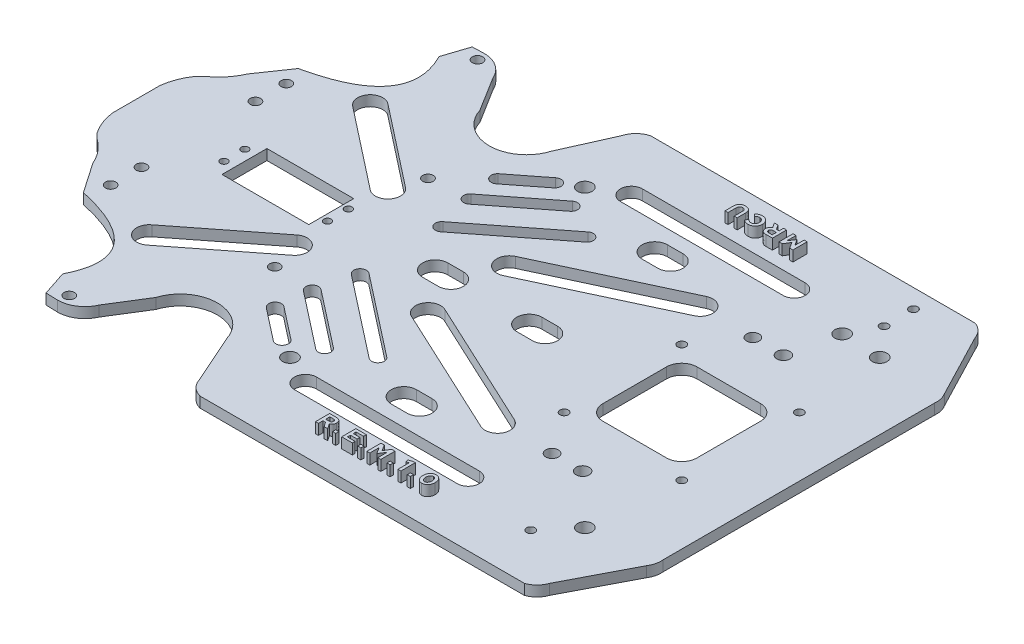
from build123d import *

# Parameters (mm, degrees)
SKETCH1_R           = 2.5
SKETCH1_R_2         = 3.5
SKETCH1_R_3         = 2
SKETCH1_R_4         = 3
SKETCH1_R_5         = 3.15
SKETCH1_R_6         = 1.75
SKETCH1_W           = 41.5
SKETCH1_H           = 21.5
BOSS_EXTRUDE1_DEPTH = 5
WRAP1_START         = -10
WRAP1_OUTLINE_W     = 1.506426403
WRAP1_OUTLINE_H     = 1.506425041
WRAP1_OUTLINE_W_2   = 1.506426404
WRAP1_DEPTH         = 5


# Read off the part's stored shape, not the designer's step: Wrap1
with BuildPart() as part:
    # Sketch1 → Boss-Extrude1 (new body)
    with BuildSketch(Plane(origin=(0, 0, 0), x_dir=(1, 0, 0), z_dir=(0, 1, 0))):
        with BuildLine():
            Line((-131.97838276, 25.717888608), (-134.624078241, 23.072193127))
            ThreePointArc((-134.624078241, 23.072193127), (-137.62017418, 17.349874646), (-139.171800992, 11.079789007))
            Line((-139.171800992, 11.079789007), (-139.171800992, -11.585375555))
            ThreePointArc((-139.171800992, -11.585375555), (-137.62017418, -17.855461194), (-134.624078241, -23.577779675))
            Line((-134.624078241, -23.577779675), (-131.97838276, -26.223475156))
            ThreePointArc((-131.97838276, -26.223475156), (-126.720677985, -31.130670242), (-122.996132988, -37.283050893))
            Line((-122.996132988, -37.283050893), (-113.160451932, -51.598877887))
            add(Edge.make_bspline(
                [(-113.160451932, -51.598877887), (-69.655489411, -61.18576478), (-84.427649619, -90.240012804)],
                knots=[0, 0, 0, 1, 1, 1], degree=2))
            Line((-84.427649619, -90.240012804), (-80.508790139, -102.148859929))
            Line((-80.508790139, -102.148859929), (-74.827782519, -102.329739895))
            ThreePointArc((-74.827782519, -102.329739895), (-67.636098928, -100.180544234), (-62.810313036, -94.431531678))
            Line((-62.810313036, -94.431531678), (-52.418708237, -77.753553279))
            ThreePointArc((-52.418708237, -77.753553279), (-35.436573268, -65.267780368), (-18.4544383, -77.753553279))
            Line((-18.4544383, -77.753553279), (-8.014534935, -101.180532239))
            ThreePointArc((-8.014534935, -101.180532239), (-5.407463763, -105.532372171), (-0.984727721, -108.017273936))
            Line((-0.984727721, -108.017273936), (154.08956069, -108.017273936))
            ThreePointArc((154.08956069, -108.017273936), (157.81628998, -105.69688437), (160.148298335, -101.977414519))
            Line((160.148298335, -101.977414519), (176.019668314, -71.459248868))
            ThreePointArc((176.019668314, -71.459248868), (177.308728073, -68.443791093), (177.525663914, -65.171544236))
            Line((177.525663914, -65.171544236), (177.525663914, 64.665957688))
            ThreePointArc((177.525663914, 64.665957688), (177.308728073, 67.938204545), (176.019668314, 70.95366232))
            Line((176.019668314, 70.95366232), (160.148298335, 101.471827971))
            ThreePointArc((160.148298335, 101.471827971), (157.81628998, 105.191297821), (154.08956069, 107.511687388))
            Line((154.08956069, 107.511687388), (-0.984727721, 107.511687388))
            ThreePointArc((-0.984727721, 107.511687388), (-5.407463763, 105.026785622), (-8.014534935, 100.674945691))
            Line((-8.014534935, 100.674945691), (-18.4544383, 77.247966731))
            ThreePointArc((-18.4544383, 77.247966731), (-35.436573268, 64.76219382), (-52.418708237, 77.247966731))
            Line((-52.418708237, 77.247966731), (-62.810313036, 93.925945129))
            ThreePointArc((-62.810313036, 93.925945129), (-67.636098928, 99.674957686), (-74.827782519, 101.824153347))
            Line((-74.827782519, 101.824153347), (-80.508790139, 101.643273381))
            Line((-80.508790139, 101.643273381), (-84.427649619, 89.734426256))
            add(Edge.make_bspline(
                [(-84.427649619, 89.734426256), (-69.655489411, 60.680178232), (-113.160451932, 51.093291339)],
                knots=[0, 0, 0, 1, 1, 1], degree=2))
            Line((-113.160451932, 51.093291339), (-122.996132988, 36.777464345))
            ThreePointArc((-122.996132988, 36.777464345), (-126.720677985, 30.625083694), (-131.97838276, 25.717888608))
        make_face()
        with Locations(Location((-36.642164959, 36.630202961, 0), (0, 0, 270))):
            Circle(SKETCH1_R, mode=Mode.SUBTRACT)
        with Locations(Location((-36.642164959, -36.630202961, 0), (0, 0, 270))):
            Circle(SKETCH1_R, mode=Mode.SUBTRACT)
        with Locations(Location((-73.905296724, -97.603035068, 0), (0, 0, 270))):
            Circle(SKETCH1_R, mode=Mode.SUBTRACT)
        with Locations(Location((-73.905296724, 97.603035068, 0), (0, 0, 270))):
            Circle(SKETCH1_R, mode=Mode.SUBTRACT)
        with Locations(Location((-109.755224174, -27.254093608, 0), (0, 0, 270))):
            Circle(SKETCH1_R, mode=Mode.SUBTRACT)
        with Locations(Location((145.5, 70.5, 0), (0, 0, 270))):
            Circle(SKETCH1_R_2, mode=Mode.SUBTRACT)
        with Locations(Location((4.5, 70.5, 0), (0, 0, 270))):
            Circle(SKETCH1_R_2, mode=Mode.SUBTRACT)
        with Locations(Location((4.5, -70.5, 0), (0, 0, 270))):
            Circle(SKETCH1_R_2, mode=Mode.SUBTRACT)
        with Locations(Location((145.5, -70.5, 0), (0, 0, 270))):
            Circle(SKETCH1_R_2, mode=Mode.SUBTRACT)
        with Locations(Location((-109.755224174, -41.994093608, 0), (0, 0, 270))):
            Circle(SKETCH1_R, mode=Mode.SUBTRACT)
        with Locations(Location((-109.755224174, 41.994093608, 0), (0, 0, 270))):
            Circle(SKETCH1_R, mode=Mode.SUBTRACT)
        with Locations(Location((-109.755224174, 27.254093608, 0), (0, 0, 270))):
            Circle(SKETCH1_R, mode=Mode.SUBTRACT)
        with Locations(Location((133.617169417, -84.482617886, 0), (0, 0, 270))):
            Circle(SKETCH1_R_3, mode=Mode.SUBTRACT)
        with Locations(Location((133.617169417, 84.482617886, 0), (0, 0, 270))):
            Circle(SKETCH1_R_3, mode=Mode.SUBTRACT)
        with Locations(Location((133.617169417, 98.534958019, 0), (0, 0, 270))):
            Circle(SKETCH1_R_3, mode=Mode.SUBTRACT)
        with Locations(Location((126.785350398, 71.251763002, 0), (0, 0, 270))):
            Circle(SKETCH1_R_2, mode=Mode.SUBTRACT)
        with Locations(Location((106.941717469, 48.397168049, 0), (0, 0, 270))):
            Circle(SKETCH1_R_4, mode=Mode.SUBTRACT)
        with Locations(Location((121.566717469, 48.397168049, 0), (0, 0, 270))):
            Circle(SKETCH1_R_5, mode=Mode.SUBTRACT)
        with Locations(Location((149.066717469, -27.727831951, 0), (0, 0, 270))):
            Circle(SKETCH1_R_3, mode=Mode.SUBTRACT)
        with Locations(Location((121.566717469, -47.602831951, 0), (0, 0, 270))):
            Circle(SKETCH1_R_5, mode=Mode.SUBTRACT)
        with Locations(Location((106.941717469, -47.602831951, 0), (0, 0, 270))):
            Circle(SKETCH1_R_4, mode=Mode.SUBTRACT)
        with Locations(Location((149.066717469, 28.522168049, 0), (0, 0, 270))):
            Circle(SKETCH1_R_3, mode=Mode.SUBTRACT)
        with Locations(Location((92.816717469, 28.522168049, 0), (0, 0, 270))):
            Circle(SKETCH1_R_3, mode=Mode.SUBTRACT)
        with Locations(Location((92.816717469, -27.727831951, 0), (0, 0, 270))):
            Circle(SKETCH1_R_3, mode=Mode.SUBTRACT)
        with Locations(Location((-92.478968026, 4.913375905, 0), (0, 0, 270))):
            Circle(SKETCH1_R_6, mode=Mode.SUBTRACT)
        with Locations(Location((-92.478968026, -5.086624095, 0), (0, 0, 270))):
            Circle(SKETCH1_R_6, mode=Mode.SUBTRACT)
        with Locations(Location((-42.978968026, -5.086624095, 0), (0, 0, 270))):
            Circle(SKETCH1_R_6, mode=Mode.SUBTRACT)
        with Locations(Location((-42.978968026, 4.913375905, 0), (0, 0, 270))):
            Circle(SKETCH1_R_6, mode=Mode.SUBTRACT)
        with BuildLine():
            Line((-18.104688203, 50.654148611), (-2.738478508, 62.65954738))
            ThreePointArc((-2.738478508, 62.65954738), (-2.129164012, 66.945049932), (-6.436015983, 67.378434735))
            Line((-6.436015983, 67.378434735), (-21.802225678, 55.373035966))
            ThreePointArc((-21.802225678, 55.373035966), (-22.218219335, 51.23901214), (-18.104688203, 50.654148611))
        make_face(mode=Mode.SUBTRACT)
        with BuildLine():
            Line((21.618278356, 14.369542206), (83.873848516, 43.399791334))
            ThreePointArc((83.873848516, 43.399791334), (86.775985667, 51.373347626), (78.802429375, 54.275484778))
            Line((78.802429375, 54.275484778), (16.546859215, 25.24523565))
            ThreePointArc((16.546859215, 25.24523565), (13.644722064, 17.271679357), (21.618278356, 14.369542206))
        make_face(mode=Mode.SUBTRACT)
        with BuildLine():
            Line((55.566717469, 66.397168049), (48.066717469, 66.397168049))
            ThreePointArc((48.066717469, 66.397168049), (42.066717469, 60.397168049), (48.066717469, 54.397168049))
            Line((48.066717469, 54.397168049), (55.566717469, 54.397168049))
            ThreePointArc((55.566717469, 54.397168049), (61.566717469, 60.397168049), (55.566717469, 66.397168049))
        make_face(mode=Mode.SUBTRACT)
        with BuildLine():
            Line((18.952031041, 73.069651302), (96.809281898, 73.069651302))
            ThreePointArc((96.809281898, 73.069651302), (102.059281898, 78.319651302), (96.809281898, 83.569651302))
            Line((96.809281898, 83.569651302), (18.952031041, 83.569651302))
            ThreePointArc((18.952031041, 83.569651302), (13.702031041, 78.319651302), (18.952031041, 73.069651302))
        make_face(mode=Mode.SUBTRACT)
        with BuildLine():
            Line((55.566717469, 6.397168049), (48.066717469, 6.397168049))
            ThreePointArc((48.066717469, 6.397168049), (42.066717469, 0.397168049), (48.066717469, -5.602831951))
            Line((48.066717469, -5.602831951), (55.566717469, -5.602831951))
            ThreePointArc((55.566717469, -5.602831951), (61.566717469, 0.397168049), (55.566717469, 6.397168049))
        make_face(mode=Mode.SUBTRACT)
        with BuildLine():
            Line((98.441717469, 15.589450855), (98.441717469, -14.795114757))
            ThreePointArc((98.441717469, -14.795114757), (100.58209828, -19.96245114), (105.749434663, -22.102831951))
            Line((105.749434663, -22.102831951), (136.134000275, -22.102831951))
            ThreePointArc((136.134000275, -22.102831951), (141.301336658, -19.96245114), (143.441717469, -14.795114757))
            Line((143.441717469, -14.795114757), (143.441717469, 15.589450855))
            ThreePointArc((143.441717469, 15.589450855), (141.301336658, 20.756787238), (136.134000275, 22.897168049))
            Line((136.134000275, 22.897168049), (105.749434663, 22.897168049))
            ThreePointArc((105.749434663, 22.897168049), (100.58209828, 20.756787238), (98.441717469, 15.589450855))
        make_face(mode=Mode.SUBTRACT)
        with BuildLine():
            Line((83.873848516, -42.605455236), (21.618278356, -13.575206108))
            ThreePointArc((21.618278356, -13.575206108), (13.644722064, -16.477343259), (16.546859215, -24.450899552))
            Line((16.546859215, -24.450899552), (78.802429375, -53.48114868))
            ThreePointArc((78.802429375, -53.48114868), (86.775985667, -50.579011528), (83.873848516, -42.605455236))
        make_face(mode=Mode.SUBTRACT)
        with BuildLine():
            Line((55.566717469, -53.602831951), (48.066717469, -53.602831951))
            ThreePointArc((48.066717469, -53.602831951), (42.066717469, -59.602831951), (48.066717469, -65.602831951))
            Line((48.066717469, -65.602831951), (55.566717469, -65.602831951))
            ThreePointArc((55.566717469, -65.602831951), (61.566717469, -59.602831951), (55.566717469, -53.602831951))
        make_face(mode=Mode.SUBTRACT)
        with BuildLine():
            Line((96.809281898, -72.275315204), (18.952031041, -72.275315204))
            ThreePointArc((18.952031041, -72.275315204), (13.702031041, -77.525315204), (18.952031041, -82.775315204))
            Line((18.952031041, -82.775315204), (96.809281898, -82.775315204))
            ThreePointArc((96.809281898, -82.775315204), (102.059281898, -77.525315204), (96.809281898, -72.275315204))
        make_face(mode=Mode.SUBTRACT)
        with BuildLine():
            Line((-2.738478508, -62.815802297), (-18.104688203, -50.810403528))
            ThreePointArc((-18.104688203, -50.810403528), (-22.218219335, -51.395267057), (-21.802225678, -55.529290883))
            Line((-21.802225678, -55.529290883), (-6.436015983, -67.534689652))
            ThreePointArc((-6.436015983, -67.534689652), (-2.129164012, -67.101304849), (-2.738478508, -62.815802297))
        make_face(mode=Mode.SUBTRACT)
        with BuildLine():
            Line((10.974941138, -56.189767154), (-16.211429862, -34.949446255))
            ThreePointArc((-16.211429862, -34.949446255), (-20.422446548, -35.46649409), (-19.905398714, -39.677510776))
            Line((-19.905398714, -39.677510776), (7.280972286, -60.917831675))
            ThreePointArc((7.280972286, -60.917831675), (11.491988973, -60.40078384), (10.974941138, -56.189767154))
        make_face(mode=Mode.SUBTRACT)
        with BuildLine():
            Line((27.505182239, -47.214042719), (-11.501350064, -16.73879969))
            ThreePointArc((-11.501350064, -16.73879969), (-15.712366751, -17.255847525), (-15.195318916, -21.466864212))
            Line((-15.195318916, -21.466864212), (23.811213387, -51.94210724))
            ThreePointArc((23.811213387, -51.94210724), (28.022230074, -51.425059406), (27.505182239, -47.214042719))
        make_face(mode=Mode.SUBTRACT)
        with BuildLine():
            Line((10.566717469, 6.397168049), (3.066717469, 6.397168049))
            ThreePointArc((3.066717469, 6.397168049), (-2.933282531, 0.397168049), (3.066717469, -5.602831951))
            Line((3.066717469, -5.602831951), (10.566717469, -5.602831951))
            ThreePointArc((10.566717469, -5.602831951), (16.566717469, 0.397168049), (10.566717469, 6.397168049))
        make_face(mode=Mode.SUBTRACT)
        with BuildLine():
            Line((-11.501350064, 17.533135788), (27.505182239, 48.008378817))
            ThreePointArc((27.505182239, 48.008378817), (28.022230074, 52.219395504), (23.811213387, 52.736443338))
            Line((23.811213387, 52.736443338), (-15.195318916, 22.26120031))
            ThreePointArc((-15.195318916, 22.26120031), (-15.712366751, 18.050183623), (-11.501350064, 17.533135788))
        make_face(mode=Mode.SUBTRACT)
        with BuildLine():
            Line((-16.211429862, 35.743782353), (10.974941138, 56.984103252))
            ThreePointArc((10.974941138, 56.984103252), (11.491988973, 61.195119938), (7.280972286, 61.712167773))
            Line((7.280972286, 61.712167773), (-19.905398714, 40.471846874))
            ThreePointArc((-19.905398714, 40.471846874), (-20.422446548, 36.260830188), (-16.211429862, 35.743782353))
        make_face(mode=Mode.SUBTRACT)
        with BuildLine():
            Line((-38.099872951, 27.371804876), (-77.060715194, 57.905438327))
            ThreePointArc((-77.060715194, 57.905438327), (-85.580659628, 56.963835582), (-84.464587763, 48.464985514))
            Line((-84.464587763, 48.464985514), (-45.50374552, 17.931352063))
            ThreePointArc((-45.50374552, 17.931352063), (-37.177380086, 19.024773187), (-38.099872951, 27.371804876))
        make_face(mode=Mode.SUBTRACT)
        with BuildLine():
            Line((-44.50374552, -18.08760698), (-83.464587763, -48.621240431))
            ThreePointArc((-83.464587763, -48.621240431), (-84.580659628, -57.1200905), (-76.060715194, -58.061693245))
            Line((-76.060715194, -58.061693245), (-37.099872951, -27.528059794))
            ThreePointArc((-37.099872951, -27.528059794), (-36.177380086, -19.181028105), (-44.50374552, -18.08760698))
        make_face(mode=Mode.SUBTRACT)
        with Locations((-66.759608096, -0.25)):
            Rectangle(SKETCH1_W, SKETCH1_H, mode=Mode.SUBTRACT)
    extrude(amount=BOSS_EXTRUDE1_DEPTH)

    # Wrap1 outline → Wrap1 (add)
    # profile 1 of 13: a face of its own
    with BuildSketch(Plane(origin=(0, 15, 0), x_dir=(1, 0, 0), z_dir=(0, 1, 0)).offset(WRAP1_START)):
        with BuildLine():
            Line((48.019988529, -96.011695946), (46.454869958, -93.610215346))
            add(Edge.make_bspline(
                [(46.454869958, -93.610215346), (46.504926209, -93.589905955), (46.604332063, -93.54957388), (46.746431819, -93.476129365), (46.882317989, -93.395768105), (47.009822853, -93.304874378), (47.127802598, -93.203551697), (47.240721538, -93.096488801), (47.343923833, -92.978209342), (47.440061574, -92.851854894), (47.527692434, -92.715878637), (47.602269852, -92.56923464), (47.666942527, -92.413569916), (47.719807761, -92.248350764), (47.761622276, -92.073035791), (47.792237819, -91.888031927), (47.809921129, -91.693137089), (47.814028037, -91.560334944), (47.816128324, -91.49241946)],
                knots=[0, 0, 0, 0, 0.060156755, 0.119464273, 0.178009028, 0.235938657, 0.29364319, 0.351161413, 0.409151229, 0.468309249, 0.527943894, 0.589106854, 0.651348349, 0.715565379, 0.782155878, 0.851987937, 0.924306111, 1, 1, 1, 1], degree=3))
            Line((47.816128324, -91.49241946), (47.8175218, -91.472199758))
            add(Edge.make_bspline(
                [(47.8175218, -91.472199758), (47.81493407, -91.391927622), (47.809887266, -91.235374261), (47.783607178, -91.007377036), (47.739983419, -90.792934182), (47.682200709, -90.590641067), (47.605415416, -90.401704177), (47.51076168, -90.226764215), (47.403053015, -90.062399138), (47.315770107, -89.965888478), (47.272141504, -89.917647357)],
                knots=[0, 0, 0, 0, 0.142719784, 0.278343931, 0.407360832, 0.531328976, 0.651804358, 0.769015275, 0.884541643, 1, 1, 1, 1], degree=3))
            add(Edge.make_bspline(
                [(47.272141504, -89.917647357), (47.218263671, -89.863888144), (47.109310796, -89.755175143), (46.916134411, -89.620999525), (46.703211966, -89.504276472), (46.466617607, -89.409496543), (46.207539889, -89.336036469), (45.925879171, -89.284272069), (45.622413102, -89.249936482), (45.412456383, -89.245062772), (45.304025084, -89.242545764)],
                knots=[0, 0, 0, 0, 0.10657219, 0.215512502, 0.328455042, 0.446650848, 0.572152058, 0.705556222, 0.8479357, 1, 1, 1, 1], degree=3))
            Line((45.304025084, -89.242545764), (42.204693684, -89.241879675))
            Line((42.204693684, -89.241879675), (42.204693684, -96.011695946))
            Line((42.204693684, -96.011695946), (43.621850455, -96.011695946))
            Line((43.621850455, -96.011695946), (43.621850455, -93.86088844))
            Line((43.621850455, -93.86088844), (44.848933305, -93.86088844))
            Line((44.848933305, -93.86088844), (46.370110393, -96.011695946))
            Line((46.370110393, -96.011695946), (48.019988529, -96.011695946))
        make_face()
        with BuildLine():
            Line((43.621850455, -90.56273269), (45.173451084, -90.56273269))
            add(Edge.make_bspline(
                [(45.173451084, -90.56273269), (45.219782586, -90.56394432), (45.310429066, -90.566314847), (45.442665875, -90.576911735), (45.567649249, -90.596406109), (45.684186116, -90.624120589), (45.793128525, -90.658976762), (45.893393111, -90.70225621), (45.986590883, -90.752724243), (46.071475448, -90.810884694), (46.147799831, -90.877290252), (46.214974272, -90.950790869), (46.271085976, -91.032797207), (46.317602803, -91.121655974), (46.354404834, -91.218459098), (46.378076452, -91.323751543), (46.396215247, -91.435549225), (46.39803832, -91.512796688), (46.398972915, -91.552397494)],
                knots=[0, 0, 0, 0, 0.077775575, 0.152166058, 0.222466345, 0.28984344, 0.353013683, 0.414181118, 0.472843596, 0.530632924, 0.58649361, 0.64228886, 0.697265122, 0.752759469, 0.81029538, 0.870479417, 0.933601449, 1, 1, 1, 1], degree=3))
            Line((46.398972915, -91.552397494), (46.400365029, -91.571050728))
            add(Edge.make_bspline(
                [(46.400365029, -91.571050728), (46.398678746, -91.607201216), (46.395370664, -91.678119804), (46.379733604, -91.781079901), (46.356583606, -91.879251994), (46.32119376, -91.970500653), (46.278219384, -92.05747798), (46.222341181, -92.136548344), (46.160459802, -92.212817947), (46.086572022, -92.280547819), (46.00649342, -92.344713377), (45.914586118, -92.396331089), (45.816755589, -92.443488273), (45.709774591, -92.480283696), (45.595443012, -92.511935214), (45.471883526, -92.53144112), (45.340639688, -92.546285507), (45.250137983, -92.548544804), (45.203596748, -92.549706665)],
                knots=[0, 0, 0, 0, 0.062280145, 0.122178709, 0.179075065, 0.235581385, 0.290365476, 0.345662015, 0.401940991, 0.459146338, 0.517921367, 0.578203968, 0.640164611, 0.704739313, 0.772713832, 0.844186612, 0.919871703, 1, 1, 1, 1], degree=3))
            Line((45.203596748, -92.549706665), (43.621850455, -92.549675336))
            Line((43.621850455, -92.549675336), (43.621850455, -90.56273269))
        make_face(mode=Mode.SUBTRACT)
    # profile 2 of 13: a face of its own
    with BuildSketch(Plane(origin=(0, 15, 0), x_dir=(1, 0, 0), z_dir=(0, 1, 0)).offset(WRAP1_START)):
        with BuildLine():
            Line((96.057437495, -92.626422755), (96.058830971, -92.605775339))
            add(Edge.make_bspline(
                [(96.058830971, -92.605775339), (96.054882992, -92.483771325), (96.047136169, -92.244371948), (96.007996762, -91.893566852), (95.944854788, -91.55948461), (95.861623073, -91.241109926), (95.747908028, -90.941594802), (95.615074618, -90.657327537), (95.456209852, -90.390881888), (95.275369087, -90.143147084), (95.074832194, -89.916370817), (94.850800177, -89.720097108), (94.609462824, -89.551657779), (94.349998251, -89.410394389), (94.070072272, -89.302312772), (93.772931108, -89.221230538), (93.45690449, -89.168610599), (93.239603551, -89.158470848), (93.128277693, -89.153276132)],
                knots=[0, 0, 0, 0, 0.072144134, 0.141563054, 0.208409952, 0.273017716, 0.335814469, 0.397536687, 0.45829914, 0.518884153, 0.578643629, 0.636874037, 0.694519606, 0.752322888, 0.811072552, 0.871485232, 0.934160353, 1, 1, 1, 1], degree=3))
            add(Edge.make_bspline(
                [(93.128277693, -89.153276132), (93.015994688, -89.158306288), (92.796715259, -89.168129765), (92.478691037, -89.22301312), (92.179189826, -89.303227173), (91.897906018, -89.413680688), (91.636195422, -89.555461686), (91.392734068, -89.725655454), (91.16821876, -89.924783682), (90.965857069, -90.152866732), (90.783096034, -90.402204061), (90.624322096, -90.670809056), (90.487965613, -90.955786507), (90.376449179, -91.257422357), (90.290400005, -91.576514317), (90.226171222, -91.911139534), (90.186703531, -92.26330836), (90.180150831, -92.503575728), (90.176800482, -92.626422755)],
                knots=[0, 0, 0, 0, 0.065977829, 0.128849248, 0.189152058, 0.247892821, 0.305949344, 0.363618992, 0.422055999, 0.481831844, 0.542424132, 0.603420238, 0.664878245, 0.727798899, 0.792078771, 0.858831854, 0.927821713, 1, 1, 1, 1], degree=3))
            Line((90.176800482, -92.626422755), (90.178193958, -92.644367673))
            add(Edge.make_bspline(
                [(90.178193958, -92.644367673), (90.18109443, -92.766806021), (90.186775568, -93.006625352), (90.224764834, -93.357918251), (90.287369515, -93.692286637), (90.373729817, -94.009511548), (90.483045394, -94.310110762), (90.614857848, -94.594441996), (90.773997035, -94.860134661), (90.95322415, -95.108258785), (91.152470829, -95.335471263), (91.376511037, -95.531313315), (91.617801246, -95.699771133), (91.877597785, -95.841392679), (92.158636172, -95.94907497), (92.457565999, -96.030410675), (92.775963139, -96.082801364), (92.995104188, -96.092967252), (93.107355123, -96.09817454)],
                knots=[0, 0, 0, 0, 0.072289224, 0.141592512, 0.208356853, 0.272956613, 0.335485668, 0.397014796, 0.457702206, 0.518050891, 0.577553826, 0.635712319, 0.693286695, 0.751018588, 0.809951373, 0.870554279, 0.933693833, 1, 1, 1, 1], degree=3))
            Line((93.107355123, -96.09817454), (93.108651886, -96.097448516))
            add(Edge.make_bspline(
                [(93.108651886, -96.097448516), (93.220507536, -96.092694115), (93.439837083, -96.083371559), (93.75825826, -96.028247931), (94.059585696, -95.948700402), (94.340842783, -95.836040012), (94.604042745, -95.696338905), (94.847040606, -95.525682168), (95.071524445, -95.326636541), (95.274128961, -95.099034853), (95.45505979, -94.848731601), (95.61438177, -94.581032468), (95.749082225, -94.295570718), (95.858793384, -93.993746209), (95.945567902, -93.67556599), (96.007827946, -93.340629972), (96.047512883, -92.989082265), (96.054088239, -92.748809339), (96.057437495, -92.626422755)],
                knots=[0, 0, 0, 0, 0.065728123, 0.12888146, 0.189459857, 0.248566924, 0.306505586, 0.364186636, 0.422635199, 0.482422863, 0.542866177, 0.603874344, 0.665227202, 0.728065927, 0.79235851, 0.85880538, 0.928080423, 1, 1, 1, 1], degree=3))
        make_face()
        with BuildLine():
            Line((91.595350729, -92.626422755), (91.595350729, -92.605775339))
            add(Edge.make_bspline(
                [(91.595350729, -92.605775339), (91.597139968, -92.529373723), (91.600646663, -92.379635691), (91.622767104, -92.160329566), (91.653002529, -91.951106878), (91.700291397, -91.753913937), (91.756262124, -91.56711006), (91.828300285, -91.392734853), (91.910369399, -91.228519539), (92.004477809, -91.07665797), (92.110652956, -90.940218153), (92.224841483, -90.818590667), (92.350304838, -90.716718557), (92.483033178, -90.629733275), (92.627079052, -90.564798994), (92.778870616, -90.51507901), (92.940213999, -90.484370785), (93.050971588, -90.477622884), (93.107355123, -90.474187719)],
                knots=[0, 0, 0, 0, 0.078711493, 0.154265115, 0.226962705, 0.296334301, 0.363006885, 0.427680651, 0.49045289, 0.551997531, 0.61140768, 0.668332258, 0.723475261, 0.777559339, 0.831360502, 0.885747124, 0.941837114, 1, 1, 1, 1], degree=3))
            add(Edge.make_bspline(
                [(93.107355123, -90.474187719), (93.164231437, -90.47745786), (93.275599668, -90.483861048), (93.437703554, -90.516794269), (93.590493938, -90.567531903), (93.735806913, -90.634048435), (93.870573777, -90.722099837), (93.996266146, -90.827606043), (94.114840813, -90.949603477), (94.220959847, -91.090584718), (94.316198817, -91.245336787), (94.40259667, -91.410052935), (94.472751613, -91.587310915), (94.533629351, -91.774225867), (94.578877514, -91.972786464), (94.61176378, -92.181601152), (94.635276334, -92.400406792), (94.638591885, -92.550108091), (94.640282086, -92.626422755)],
                knots=[0, 0, 0, 0, 0.058115573, 0.113794795, 0.168293592, 0.222243687, 0.276499995, 0.332120486, 0.389535646, 0.449832663, 0.511883552, 0.574948708, 0.639483568, 0.706297352, 0.775510525, 0.847162292, 0.922086458, 1, 1, 1, 1], degree=3))
            Line((94.640282086, -92.626422755), (94.641674199, -92.644367673))
            add(Edge.make_bspline(
                [(94.641674199, -92.644367673), (94.6390791, -92.72071021), (94.634009853, -92.869837113), (94.615471654, -93.088612997), (94.581557596, -93.295794699), (94.537184144, -93.492624478), (94.480420506, -93.678483753), (94.409745348, -93.853312304), (94.330203376, -94.018953099), (94.234552185, -94.170128273), (94.13127852, -94.308927575), (94.015699554, -94.429757225), (93.891329336, -94.534091764), (93.756537665, -94.619478307), (93.612816858, -94.687395614), (93.459439644, -94.736186202), (93.296827375, -94.76712669), (93.185133066, -94.773843777), (93.128277693, -94.777262953)],
                knots=[0, 0, 0, 0, 0.078627062, 0.153589477, 0.225820764, 0.294553485, 0.361163863, 0.425598013, 0.488526815, 0.550014035, 0.60945745, 0.666328918, 0.721725232, 0.776162194, 0.830115206, 0.884906578, 0.941414388, 1, 1, 1, 1], degree=3))
            Line((93.128277693, -94.777262953), (93.128563743, -94.776594139))
            add(Edge.make_bspline(
                [(93.128563743, -94.776594139), (93.071152525, -94.773454794), (92.958887502, -94.767315948), (92.795012972, -94.736398469), (92.641320411, -94.685541976), (92.495362378, -94.618483463), (92.360200992, -94.531021818), (92.233307303, -94.427167826), (92.117135134, -94.304193857), (92.010545146, -94.165135856), (91.914196035, -94.011551028), (91.831108033, -93.845392022), (91.759515116, -93.668692288), (91.701078402, -93.48109578), (91.655338002, -93.282886791), (91.621945106, -93.073657215), (91.600855838, -92.853737853), (91.597209781, -92.703186082), (91.595350729, -92.626422755)],
                knots=[0, 0, 0, 0, 0.058589863, 0.114569811, 0.169446597, 0.223324995, 0.277908095, 0.333152336, 0.390162884, 0.450003403, 0.511569662, 0.574757691, 0.639206786, 0.705788437, 0.774909629, 0.846466173, 0.921716183, 1, 1, 1, 1], degree=3))
        make_face(mode=Mode.SUBTRACT)
    # profile 3 of 13: a face of its own
    with BuildSketch(Plane(origin=(0, 15, 0), x_dir=(1, 0, 0), z_dir=(0, 1, 0)).offset(WRAP1_START)):
        with BuildLine():
            Line((54.244939395, 89.238362613), (54.244939395, 93.141299143))
            add(Edge.make_bspline(
                [(54.244939395, 93.141299143), (54.246304175, 93.206846022), (54.248954163, 93.334118159), (54.268622246, 93.518755459), (54.300598667, 93.690798203), (54.343654416, 93.850465066), (54.397699933, 93.998042059), (54.464799581, 94.132971741), (54.544774589, 94.254862736), (54.635832846, 94.364602935), (54.738273719, 94.461097083), (54.850526168, 94.54539666), (54.972745692, 94.616792815), (55.104061629, 94.675562812), (55.245459975, 94.720386489), (55.395956661, 94.75179952), (55.556477093, 94.771929074), (55.666679041, 94.774528604), (55.723464952, 94.775868115)],
                knots=[0, 0, 0, 0, 0.078376536, 0.152183436, 0.221759869, 0.287448476, 0.349728197, 0.40940702, 0.467238926, 0.523693909, 0.579546021, 0.635148482, 0.691221572, 0.748467809, 0.806847745, 0.868245049, 0.932108052, 1, 1, 1, 1], degree=3))
            add(Edge.make_bspline(
                [(55.723464952, 94.775868115), (55.779774218, 94.774444743), (55.889949699, 94.771659753), (56.050259573, 94.752442975), (56.201191448, 94.718779351), (56.342019604, 94.671710762), (56.473108661, 94.610797005), (56.595528095, 94.538540863), (56.707241855, 94.451121307), (56.810242247, 94.351891351), (56.900725926, 94.237919501), (56.980884359, 94.111985367), (57.04750022, 93.972538619), (57.103566525, 93.821417075), (57.146783339, 93.656959449), (57.176356269, 93.479955688), (57.196447331, 93.290341123), (57.200103805, 93.159769567), (57.201993233, 93.092298648)],
                knots=[0, 0, 0, 0, 0.06630717, 0.129737517, 0.189778417, 0.248127826, 0.30422719, 0.359722118, 0.415138662, 0.470894972, 0.527758639, 0.586087493, 0.646327783, 0.709386032, 0.775657022, 0.846228414, 0.920540808, 1, 1, 1, 1], degree=3))
            Line((57.201993233, 93.092298648), (57.201993233, 89.238362613))
            Line((57.201993233, 89.238362613), (58.619150005, 89.238362613))
            Line((58.619150005, 89.238362613), (58.619150005, 93.131565244))
            add(Edge.make_bspline(
                [(58.619150005, 93.131565244), (58.616381739, 93.252025849), (58.611021899, 93.48525834), (58.572387413, 93.823213213), (58.513117353, 94.138182249), (58.431909189, 94.430634809), (58.325775251, 94.699336497), (58.195031979, 94.943647539), (58.042931526, 95.166193479), (57.865809269, 95.363548768), (57.668098894, 95.53758913), (57.45020995, 95.687147959), (57.213820728, 95.815154607), (56.957786095, 95.920154664), (56.680987734, 95.998791761), (56.385561512, 96.055414428), (56.07072731, 96.091214273), (55.854214119, 96.094890994), (55.742992684, 96.096779702)],
                knots=[0, 0, 0, 0, 0.076589962, 0.148291366, 0.216020287, 0.280229623, 0.341008322, 0.3993416, 0.45609493, 0.512004043, 0.567520885, 0.623208311, 0.679699179, 0.738173904, 0.798809322, 0.862361796, 0.929296139, 1, 1, 1, 1], degree=3))
            Line((55.742992684, 96.096779702), (55.743118002, 96.097448516))
            add(Edge.make_bspline(
                [(55.743118002, 96.097448516), (55.63141829, 96.095069438), (55.414048716, 96.090439711), (55.096917086, 96.057649723), (54.800057963, 95.998420118), (54.520780228, 95.920175885), (54.262020138, 95.814281128), (54.02049261, 95.688268952), (53.799843991, 95.535554309), (53.597816429, 95.361404444), (53.417917616, 95.161335963), (53.260881096, 94.937298492), (53.129641693, 94.687380376), (53.020591928, 94.413990838), (52.936071121, 94.115649654), (52.875903459, 93.792999636), (52.835530553, 93.446196399), (52.830419236, 93.206330605), (52.827781262, 93.082534782)],
                knots=[0, 0, 0, 0, 0.069948444, 0.136120884, 0.199332388, 0.259323618, 0.317446581, 0.374103448, 0.42958705, 0.485107309, 0.540770153, 0.597635369, 0.6559876, 0.717137702, 0.781648155, 0.849829641, 0.922496397, 1, 1, 1, 1], degree=3))
            Line((52.827781262, 93.082534782), (52.827782624, 89.238362613))
            Line((52.827782624, 89.238362613), (54.244939395, 89.238362613))
        make_face()
    # profile 4 of 13: a face of its own
    with BuildSketch(Plane(origin=(0, 15, 0), x_dir=(1, 0, 0), z_dir=(0, 1, 0)).offset(WRAP1_START)):
        with BuildLine():
            Line((61.1664018, 94.933484809), (62.112121035, 93.974616774))
            add(Edge.make_bspline(
                [(62.112121035, 93.974616774), (62.176546783, 94.03368251), (62.302691489, 94.149332389), (62.499523084, 94.30696902), (62.701708389, 94.441623884), (62.906100022, 94.562424305), (63.124718531, 94.657670663), (63.360742511, 94.726196294), (63.616707734, 94.766380331), (63.793668237, 94.772639669), (63.884941064, 94.775868115)],
                knots=[0, 0, 0, 0, 0.131110854, 0.256713203, 0.377819134, 0.495309632, 0.612453841, 0.734520151, 0.863070595, 1, 1, 1, 1], degree=3))
            add(Edge.make_bspline(
                [(63.884941064, 94.775868115), (63.956666114, 94.772103933), (64.097127721, 94.764732407), (64.302437423, 94.730909207), (64.496083367, 94.677697963), (64.67996013, 94.608016884), (64.851398049, 94.517865457), (65.013696787, 94.411692983), (65.163182833, 94.284963264), (65.300756055, 94.141680808), (65.423884513, 93.984391074), (65.533456204, 93.817578365), (65.62787876, 93.64169565), (65.702436908, 93.454967245), (65.762943691, 93.26004903), (65.807353011, 93.056179632), (65.83600159, 92.842946094), (65.840832586, 92.697650382), (65.843293618, 92.623633079)],
                knots=[0, 0, 0, 0, 0.066411951, 0.130056785, 0.192041757, 0.25195479, 0.311596985, 0.370890701, 0.431033373, 0.492486211, 0.554359141, 0.615563074, 0.676948129, 0.738693834, 0.801280363, 0.865573117, 0.931519553, 1, 1, 1, 1], degree=3))
            Line((65.843293618, 92.623633079), (65.843293618, 92.605387127))
            add(Edge.make_bspline(
                [(65.843293618, 92.605387127), (65.840241042, 92.53141343), (65.834248339, 92.386190991), (65.806101407, 92.173409581), (65.761832308, 91.970232288), (65.699646133, 91.776850769), (65.623391734, 91.591924659), (65.529429117, 91.416718966), (65.418607955, 91.251792046), (65.29321044, 91.097125158), (65.155439639, 90.955415572), (65.004348127, 90.831719162), (64.844160915, 90.724915784), (64.671860497, 90.638204267), (64.49020268, 90.568234642), (64.297748974, 90.516154438), (64.094678846, 90.484399885), (63.955718216, 90.476709728), (63.884941064, 90.472792881)],
                knots=[0, 0, 0, 0, 0.068845953, 0.135155842, 0.199380509, 0.262028933, 0.323879466, 0.385221283, 0.446640817, 0.508448991, 0.570231433, 0.630152404, 0.689772907, 0.748963558, 0.809206791, 0.870585193, 0.934084846, 1, 1, 1, 1], degree=3))
            add(Edge.make_bspline(
                [(63.884941064, 90.472792881), (63.802950196, 90.475591237), (63.641284711, 90.481108895), (63.40451207, 90.521275285), (63.17786157, 90.585327068), (62.961750642, 90.676382853), (62.752874626, 90.788624194), (62.550811567, 90.923121534), (62.349579008, 91.072892032), (62.22369872, 91.187239941), (62.159526457, 91.245533134)],
                knots=[0, 0, 0, 0, 0.126838858, 0.250094505, 0.370571891, 0.490564882, 0.612248013, 0.736975452, 0.865913237, 1, 1, 1, 1], degree=3))
            Line((62.159526457, 91.245533134), (61.215482662, 90.157191714))
            add(Edge.make_bspline(
                [(61.215482662, 90.157191714), (61.293929894, 90.083560401), (61.451226936, 89.935919912), (61.715051772, 89.743606326), (61.999075455, 89.573253216), (62.251840143, 89.449905009), (62.466660344, 89.363741073), (62.639375695, 89.308995876), (62.821574308, 89.260387206), (63.01407288, 89.224862689), (63.215086738, 89.191071463), (63.426617019, 89.1698533), (63.64762291, 89.155511897), (63.798437034, 89.153105675), (63.875177198, 89.151881294)],
                knots=[0, 0, 0, 0, 0.110369112, 0.22130462, 0.334355972, 0.450063688, 0.509629028, 0.571821685, 0.635962164, 0.703083055, 0.772690248, 0.845171023, 0.921216921, 1, 1, 1, 1], degree=3))
            add(Edge.make_bspline(
                [(63.875177198, 89.151881294), (64.00320217, 89.157715959), (64.253715525, 89.169132962), (64.619443296, 89.220895126), (64.965527802, 89.303052268), (65.291459763, 89.414972057), (65.598308486, 89.55401149), (65.882489987, 89.726667287), (66.149855314, 89.924412681), (66.392158419, 90.154022345), (66.612590476, 90.403660807), (66.803952346, 90.673119765), (66.969262133, 90.957665172), (67.102164064, 91.260022896), (67.209466172, 91.577754284), (67.286837891, 91.911719288), (67.336981523, 92.262293579), (67.345418669, 92.501646771), (67.349718659, 92.623633079)],
                knots=[0, 0, 0, 0, 0.069967071, 0.136908335, 0.201396341, 0.263955045, 0.324860655, 0.385003932, 0.445238813, 0.506142834, 0.566963682, 0.626859844, 0.686359029, 0.74638371, 0.806932523, 0.869268175, 0.933372551, 1, 1, 1, 1], degree=3))
            Line((67.349718659, 92.623633079), (67.349720021, 92.644507974))
            add(Edge.make_bspline(
                [(67.349720021, 92.644507974), (67.34498844, 92.766988885), (67.33570295, 93.007351514), (67.283723094, 93.359142053), (67.206608493, 93.694541563), (67.100355518, 94.012775425), (66.965560979, 94.313806849), (66.802048835, 94.597532949), (66.60956021, 94.86445214), (66.389969016, 95.111224489), (66.147576981, 95.33613729), (65.88514099, 95.533439947), (65.603641877, 95.700402822), (65.30459624, 95.839154002), (64.987517595, 95.949854414), (64.651673701, 96.02816302), (64.298965438, 96.081458885), (64.057165837, 96.091602686), (63.933760394, 96.096779702)],
                knots=[0, 0, 0, 0, 0.06773019, 0.132917092, 0.19627314, 0.257813672, 0.318110394, 0.378344608, 0.43856291, 0.499749645, 0.560692326, 0.621105666, 0.680934195, 0.741317444, 0.803107156, 0.866272021, 0.931750258, 1, 1, 1, 1], degree=3))
            Line((63.933760394, 96.096779702), (63.934321599, 96.097448516))
            add(Edge.make_bspline(
                [(63.934321599, 96.097448516), (63.85553345, 96.096042951), (63.701252839, 96.093290615), (63.474849736, 96.077791545), (63.258323728, 96.053100289), (63.051778311, 96.017820413), (62.854948739, 95.975484616), (62.668284828, 95.921889101), (62.490957702, 95.859701159), (62.26815764, 95.762192622), (62.003466634, 95.620973575), (61.704954496, 95.420903074), (61.422276034, 95.19407076), (61.252157569, 95.020819701), (61.1664018, 94.933484809)],
                knots=[0, 0, 0, 0, 0.076290887, 0.149390546, 0.219639851, 0.28721273, 0.352206415, 0.414478441, 0.475136378, 0.534014006, 0.649820265, 0.765067759, 0.881571968, 1, 1, 1, 1], degree=3))
        make_face()
    # profile 5 of 13: a face of its own
    with BuildSketch(Plane(origin=(0, 15, 0), x_dir=(1, 0, 0), z_dir=(0, 1, 0)).offset(WRAP1_START)):
        with BuildLine():
            Line((69.640107767, 96.011695946), (71.205226339, 93.610215346))
            add(Edge.make_bspline(
                [(71.205226339, 93.610215346), (71.154725745, 93.589391971), (71.054993727, 93.548268548), (70.912248252, 93.474784438), (70.776389181, 93.394360082), (70.648876804, 93.303483184), (70.5309004, 93.202155364), (70.417975558, 93.095096322), (70.314793821, 92.976806426), (70.218577997, 92.850490733), (70.131467743, 92.714715288), (70.055687288, 92.568652903), (69.992154331, 92.412471013), (69.93880132, 92.24699076), (69.897283146, 92.072066556), (69.866209633, 91.887139047), (69.84887716, 91.692195187), (69.844701279, 91.558936783), (69.842573135, 91.491024622)],
                knots=[0, 0, 0, 0, 0.0607937, 0.120059548, 0.178563168, 0.236452095, 0.294116083, 0.351593893, 0.409542964, 0.468659419, 0.528252163, 0.588912272, 0.65158856, 0.71576047, 0.782304181, 0.851576516, 0.924359295, 1, 1, 1, 1], degree=3))
            Line((69.842573135, 91.491024622), (69.842574497, 91.472199758))
            add(Edge.make_bspline(
                [(69.842574497, 91.472199758), (69.844538201, 91.39145117), (69.848357707, 91.234390943), (69.875358584, 91.006041855), (69.918107455, 90.791213951), (69.978708594, 90.589852435), (70.052820218, 90.399947519), (70.148082245, 90.225423532), (70.255613067, 90.060990852), (70.342919561, 89.964489159), (70.386559955, 89.916252519)],
                knots=[0, 0, 0, 0, 0.143407213, 0.278934533, 0.407859324, 0.531972738, 0.652052947, 0.769180183, 0.884624073, 1, 1, 1, 1], degree=3))
            add(Edge.make_bspline(
                [(70.386559955, 89.916252519), (70.440433766, 89.862482697), (70.549378508, 89.753748243), (70.742617698, 89.619738285), (70.955135956, 89.502434086), (71.19268621, 89.410308245), (71.45083416, 89.334026501), (71.732881019, 89.283064499), (72.036272079, 89.248489739), (72.246239532, 89.243650257), (72.354676375, 89.241150926)],
                knots=[0, 0, 0, 0, 0.106578794, 0.215525856, 0.328475396, 0.446435377, 0.572125545, 0.705537976, 0.847926277, 1, 1, 1, 1], degree=3))
            Line((72.354676375, 89.241150926), (75.455402613, 89.241879675))
            Line((75.455402613, 89.241879675), (75.455402613, 96.011695946))
            Line((75.455402613, 96.011695946), (74.038245842, 96.011695946))
            Line((74.038245842, 96.011695946), (74.038245842, 93.86088844))
            Line((74.038245842, 93.86088844), (72.811162991, 93.86088844))
            Line((72.811162991, 93.86088844), (71.289985904, 96.011695946))
            Line((71.289985904, 96.011695946), (69.640107767, 96.011695946))
        make_face()
        with BuildLine():
            Line((74.038245842, 90.56273269), (72.486645213, 90.56273269))
            add(Edge.make_bspline(
                [(72.486645213, 90.56273269), (72.439843258, 90.563336144), (72.348707517, 90.564511228), (72.216051959, 90.575657995), (72.091451429, 90.594737466), (71.975126, 90.623239459), (71.865932092, 90.657249662), (71.765320667, 90.700900874), (71.672106191, 90.751318581), (71.587231468, 90.809494767), (71.510884658, 90.875886464), (71.443789397, 90.949426849), (71.387151475, 91.031630286), (71.341824336, 91.121056914), (71.303938536, 91.21738147), (71.28070052, 91.322387629), (71.262465791, 91.434146025), (71.260656219, 91.511399016), (71.259728544, 91.551002656)],
                knots=[0, 0, 0, 0, 0.078476808, 0.152815028, 0.223065925, 0.289637384, 0.353505338, 0.414629799, 0.473251064, 0.530999791, 0.586821231, 0.642577281, 0.69751492, 0.753662169, 0.810428659, 0.870570413, 0.933648098, 1, 1, 1, 1], degree=3))
            Line((71.259728544, 91.551002656), (71.259731268, 91.571050728))
            add(Edge.make_bspline(
                [(71.259731268, 91.571050728), (71.260847477, 91.606741983), (71.263051993, 91.677232303), (71.279056158, 91.77967981), (71.302094866, 91.877858512), (71.337513615, 91.969105507), (71.380480548, 92.056083071), (71.436360497, 92.135154108), (71.49824236, 92.211420708), (71.57212631, 92.279162232), (71.652220308, 92.343282585), (71.744067701, 92.395075766), (71.842275293, 92.441615266), (71.948372141, 92.481130476), (72.06355658, 92.50991899), (72.186765284, 92.530231861), (72.31807617, 92.544839913), (72.408568366, 92.547132728), (72.455104711, 92.548311827)],
                knots=[0, 0, 0, 0, 0.061482004, 0.121427117, 0.178367688, 0.234917921, 0.289744587, 0.345084098, 0.40140681, 0.458656613, 0.517477318, 0.577806766, 0.63981556, 0.704713073, 0.772537202, 0.844065525, 0.919809433, 1, 1, 1, 1], degree=3))
            Line((72.455104711, 92.548311827), (74.038245842, 92.549675336))
            Line((74.038245842, 92.549675336), (74.038245842, 90.56273269))
        make_face(mode=Mode.SUBTRACT)
    # profile 6 of 13: a face of its own
    with BuildSketch(Plane(origin=(0, 15, 0), x_dir=(1, 0, 0), z_dir=(0, 1, 0)).offset(WRAP1_START)):
        with Locations((51.152859109, -95.258482064)):
            Rectangle(WRAP1_OUTLINE_W, WRAP1_OUTLINE_H)
    # profile 7 of 13: a face of its own
    with BuildSketch(Plane(origin=(0, 15, 0), x_dir=(1, 0, 0), z_dir=(0, 1, 0)).offset(WRAP1_START)):
        with Locations((63.168551586, -95.258482064)):
            Rectangle(WRAP1_OUTLINE_W_2, WRAP1_OUTLINE_H)
    # profile 8 of 13: a face of its own
    with BuildSketch(Plane(origin=(0, 15, 0), x_dir=(1, 0, 0), z_dir=(0, 1, 0)).offset(WRAP1_START)):
        Polygon((72.038603359, -91.589449241), (72.038603359, -96.011695946), (73.455760131, -96.011695946), (73.455760131, -89.238362613), (71.912241116, -89.238362613), (70.123459454, -92.102313738), (68.334677793, -89.238362613), (66.771696429, -89.238362613), (66.771696429, -96.011695946), (68.188853201, -96.011695946), (68.188853201, -91.618479307), (70.084572897, -94.482779142), (70.123459454, -94.482779142), align=None)
    # profile 9 of 13: a face of its own
    with BuildSketch(Plane(origin=(0, 15, 0), x_dir=(1, 0, 0), z_dir=(0, 1, 0)).offset(WRAP1_START)):
        with Locations((77.148175968, -95.258482064)):
            Rectangle(WRAP1_OUTLINE_W_2, WRAP1_OUTLINE_H)
    # profile 10 of 13: a face of its own
    with BuildSketch(Plane(origin=(0, 15, 0), x_dir=(1, 0, 0), z_dir=(0, 1, 0)).offset(WRAP1_START)):
        Polygon((81.644017132, -90.667785513), (81.644017132, -96.011695946), (83.061173903, -96.011695946), (83.061173903, -89.149092981), (82.082240089, -89.149092981), (80.159261117, -89.73333123), (80.467781848, -90.959802477), align=None)
    # profile 11 of 13: a face of its own
    with BuildSketch(Plane(origin=(0, 15, 0), x_dir=(1, 0, 0), z_dir=(0, 1, 0)).offset(WRAP1_START)):
        with Locations((86.842858011, -95.258482064)):
            Rectangle(WRAP1_OUTLINE_W_2, WRAP1_OUTLINE_H)
    # profile 12 of 13: a face of its own
    with BuildSketch(Plane(origin=(0, 15, 0), x_dir=(1, 0, 0), z_dir=(0, 1, 0)).offset(WRAP1_START)):
        Polygon((56.173160724, -91.919967275), (56.173160724, -90.562734052), (59.788638033, -90.562734052), (59.788638033, -89.241879675), (54.756003953, -89.241879675), (54.756003953, -96.008178884), (59.836844397, -96.008178884), (59.836844397, -94.687324507), (56.173160724, -94.687324507), (56.173160724, -93.240821652), (59.354780756, -93.240821652), (59.354780756, -91.919967275), align=None)
    # profile 13 of 13: a face of its own
    with BuildSketch(Plane(origin=(0, 15, 0), x_dir=(1, 0, 0), z_dir=(0, 1, 0)).offset(WRAP1_START)):
        Polygon((78.573144513, 96.011695946), (78.573144513, 89.238362613), (80.116663528, 89.238362613), (81.905445189, 92.102313738), (83.694226851, 89.238362613), (85.257208215, 89.238362613), (85.257208215, 96.011695946), (83.840051443, 96.011695946), (83.840051443, 91.618479307), (81.944331747, 94.482779142), (81.905445189, 94.482779142), (79.990301284, 91.589449241), (79.990301284, 96.011695946), align=None)
    extrude(amount=WRAP1_DEPTH)


solid = part.part
